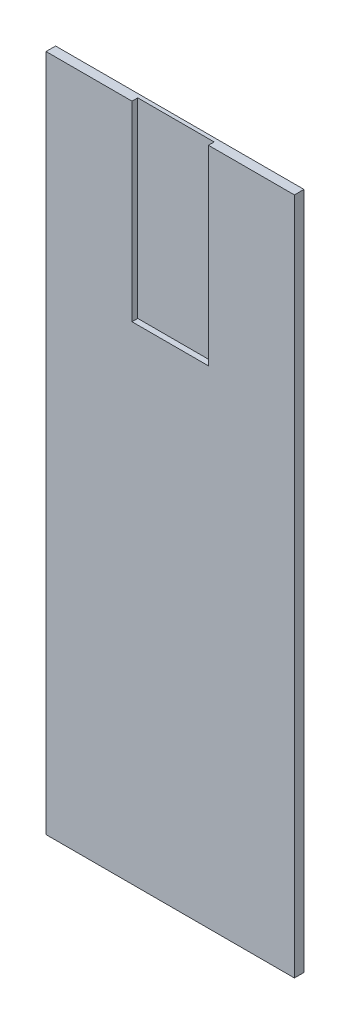
from build123d import *

# Parameters (mm, degrees)
SKETCH1_W           = 330.2
SKETCH1_H           = 901.7
BOSS_EXTRUDE1_DEPTH = 12.7
SKETCH2_W           = 101.6
SKETCH2_H           = 254
CUT_EXTRUDE1_DEPTH  = 7.62


with BuildPart() as part:
    # Sketch1 → Boss-Extrude1 (new body)
    with BuildSketch(Plane.XY):
        with Locations((165.1, 450.85)):
            Rectangle(SKETCH1_W, SKETCH1_H)
    extrude(amount=BOSS_EXTRUDE1_DEPTH)

    # Sketch2 → Cut-Extrude1 (cut)
    with BuildSketch(Plane.XY.offset(12.7)):
        with Locations((165.1, 774.7)):
            Rectangle(SKETCH2_W, SKETCH2_H)
    extrude(amount=-CUT_EXTRUDE1_DEPTH, mode=Mode.SUBTRACT)


solid = part.part
